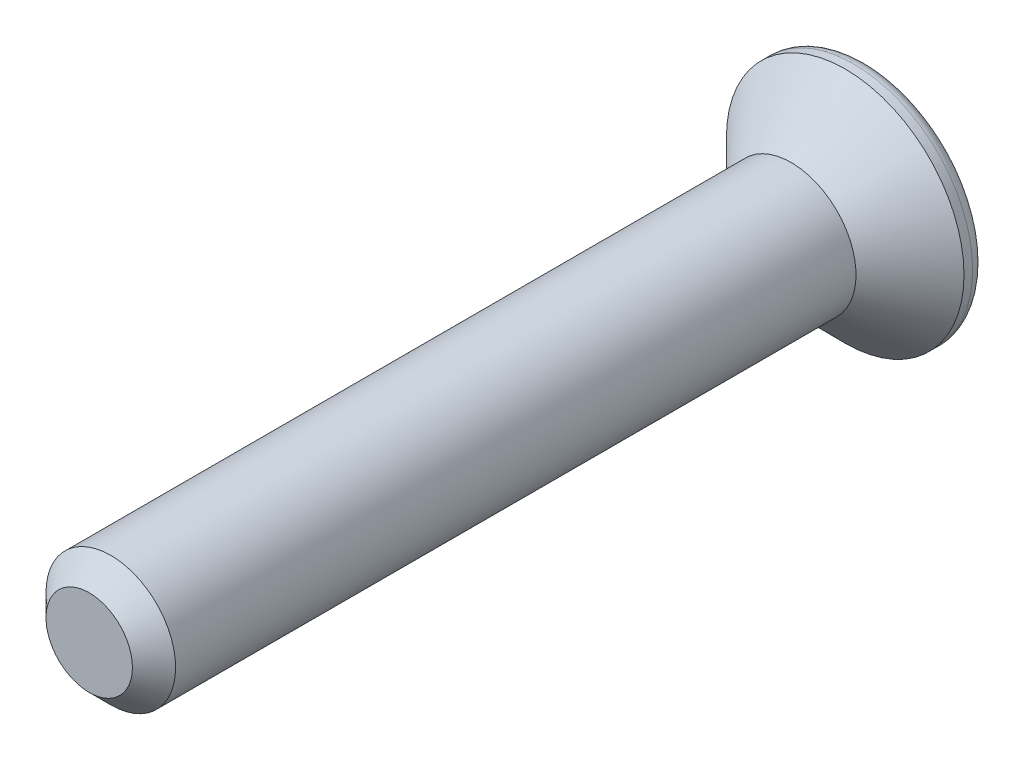
from build123d import *

# Parameters (mm, degrees)
SKETCH1_R           = 2.75
BOSS_EXTRUDE1_DEPTH = 2
SKETCH2_R           = 1.5
BOSS_EXTRUDE2_DEPTH = 16
CHAMFER1_SIZE       = 1.5
FILLET1_R           = 0.3
CHAMFER2_SIZE       = 0.5
CUT_EXTRUDE1_DEPTH  = 2
FILLET2_R           = 0.3


with BuildPart() as part:
    # Sketch1 → Boss-Extrude1 (new body)
    with BuildSketch(Plane.XY):
        Circle(SKETCH1_R)
    extrude(amount=BOSS_EXTRUDE1_DEPTH)

    # Sketch2 → Boss-Extrude2 (add)
    with BuildSketch(Plane.XY.offset(2)):
        Circle(SKETCH2_R)
    extrude(amount=BOSS_EXTRUDE2_DEPTH)

    # Chamfer1
    # the kernel refuses this chamfer: 1.5 mm, written as the material it takes off along each edge
    with BuildSketch(Plane(origin=(0, 0, 2), x_dir=(1, 0, 0), z_dir=(0, -1, 0))) as chamfer1_piece_1_section:
        Polygon((2.75, -CHAMFER1_SIZE), (2.75 - CHAMFER1_SIZE, 0), (2.75, 0), align=None)
    chamfer1_piece_1 = revolve(axis=Axis((0, 0, 2), (0, 0, 1)), mode=Mode.PRIVATE)
    chamfer1_piece_1 = chamfer1_piece_1 - Plane(origin=(0, 0, 1.122011251), x_dir=(1, 0, 0), z_dir=(0, 0, -1)) * Cylinder(1.5, 11, mode=Mode.PRIVATE)
    add(chamfer1_piece_1, mode=Mode.SUBTRACT)

    # Fillet1
    fillet1_edges = [part.edges().sort_by_distance(p)[0] for p in [
        (-2.75, 0, 0),
    ]]
    fillet(fillet1_edges, radius=FILLET1_R)

    # Chamfer2
    chamfer2_edges = [part.edges().sort_by_distance(p)[0] for p in [
        (-1.5, 0, 18),
    ]]
    chamfer(chamfer2_edges, length=CHAMFER2_SIZE)

    # Sketch3 → Cut-Extrude1 (cut)
    with BuildSketch(Plane(origin=(0, 0, 0), x_dir=(-1, 0, 0), z_dir=(0, 0, -1))):
        Polygon((0, -1.443375673), (1.25, -0.721687836), (1.25, 0.721687836), (0, 1.443375673), (-1.25, 0.721687836), (-1.25, -0.721687836), align=None)
    extrude(amount=-CUT_EXTRUDE1_DEPTH, mode=Mode.SUBTRACT)

    # Fillet2
    fillet2_edges = [part.edges().sort_by_distance(p)[0] for p in [
        (0.625, -1.082531755, 0),
        (-0.625, -1.082531755, 0),
        (-1.25, 0, 0),
        (-0.625, 1.082531755, 0),
        (0.625, 1.082531755, 0),
        (1.25, 0, 0),
    ]]
    fillet(fillet2_edges, radius=FILLET2_R)


solid = part.part
